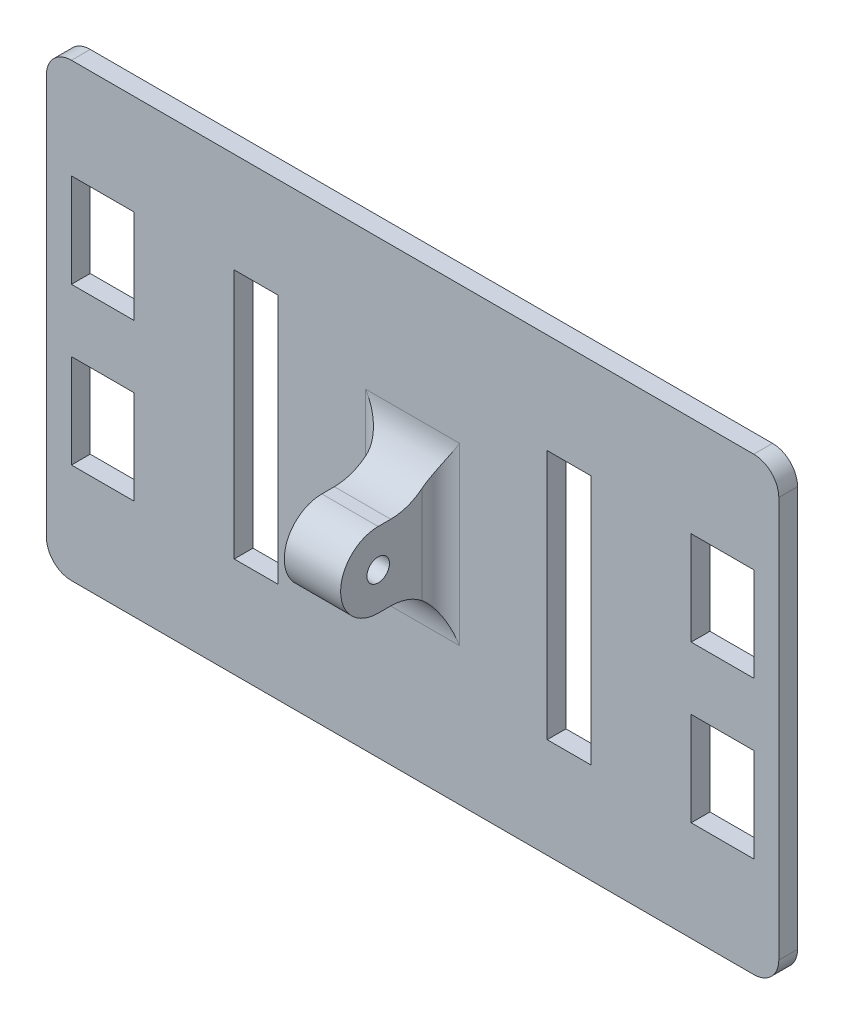
from build123d import *

# Parameters (mm, degrees)
SKETCH1_W           = 117
SKETCH1_H           = 72
BOSS_EXTRUDE1_DEPTH = 3
FILLET1_R           = 4
SKETCH2_R           = 1.8
BOSS_EXTRUDE2_DEPTH = 4.5
FILLET2_R           = 8
FILLET3_R           = 3
CUT_EXTRUDE3_REACH  = 140.687
SKETCH4_W           = 10
SKETCH4_H           = 15
SKETCH4_W_2         = 7
SKETCH4_H_2         = 40


with BuildPart() as part:
    # Sketch1 → Boss-Extrude1 (new body)
    with BuildSketch(Plane.XY):
        with Locations((58.5, 36)):
            Rectangle(SKETCH1_W, SKETCH1_H)
    extrude(amount=BOSS_EXTRUDE1_DEPTH)

    # Fillet1
    fillet1_edges = [part.edges().sort_by_distance(p)[0] for p in [
        (117, 72, 1.5),
        (0, 72, 1.5),
        (0, 0, 1.5),
        (117, 0, 1.5),
    ]]
    fillet(fillet1_edges, radius=FILLET1_R)

    # Sketch2 → Boss-Extrude2 (add, symmetric)
    with BuildSketch(Plane.ZY.offset(-58.5)):
        with BuildLine():
            Line((13, 30), (3, 30))
            Line((3, 30), (3, 42))
            Line((3, 42), (13, 42))
            ThreePointArc((13, 42), (19, 36), (13, 30))
        make_face()
        with Locations((13, 36)):
            Circle(SKETCH2_R, mode=Mode.SUBTRACT)
    extrude(amount=BOSS_EXTRUDE2_DEPTH, both=True)

    # Fillet2
    fillet2_edges = [part.edges().sort_by_distance(p)[0] for p in [
        (58.5, 42, 3),
        (58.5, 30, 3),
    ]]
    fillet(fillet2_edges, radius=FILLET2_R)

    # Fillet3
    fillet3_edges = [part.edges().sort_by_distance(p)[0] for p in [
        (54, 36, 3),
        (63, 36, 3),
    ]]
    fillet(fillet3_edges, radius=FILLET3_R)

    # Sketch4 → Cut-Extrude3 (cut, up to next)
    with BuildSketch(Plane(origin=(0, 0, 0), x_dir=(-1, 0, 0), z_dir=(0, 0, -1)), mode=Mode.PRIVATE) as cut_extrude3_sk1:
        with Locations((-108, 48.5)):
            Rectangle(SKETCH4_W, SKETCH4_H)
    cut_extrude3_tool1 = extrude(cut_extrude3_sk1.sketch, amount=-CUT_EXTRUDE3_REACH, mode=Mode.PRIVATE) & part.part
    # Sketch4 → Cut-Extrude3 (cut, up to next)
    with BuildSketch(Plane(origin=(0, 0, 0), x_dir=(-1, 0, 0), z_dir=(0, 0, -1)), mode=Mode.PRIVATE) as cut_extrude3_sk2:
        with Locations((-108, 23.5)):
            Rectangle(SKETCH4_W, SKETCH4_H)
    cut_extrude3_tool2 = extrude(cut_extrude3_sk2.sketch, amount=-CUT_EXTRUDE3_REACH, mode=Mode.PRIVATE) & part.part
    # Sketch4 → Cut-Extrude3 (cut, up to next)
    with BuildSketch(Plane(origin=(0, 0, 0), x_dir=(-1, 0, 0), z_dir=(0, 0, -1)), mode=Mode.PRIVATE) as cut_extrude3_sk3:
        with Locations((-83.5, 36)):
            Rectangle(SKETCH4_W_2, SKETCH4_H_2)
    cut_extrude3_tool3 = extrude(cut_extrude3_sk3.sketch, amount=-CUT_EXTRUDE3_REACH, mode=Mode.PRIVATE) & part.part
    # Sketch4 → Cut-Extrude3 (cut, up to next)
    with BuildSketch(Plane(origin=(0, 0, 0), x_dir=(-1, 0, 0), z_dir=(0, 0, -1)), mode=Mode.PRIVATE) as cut_extrude3_sk4:
        with Locations((-33.5, 36)):
            Rectangle(SKETCH4_W_2, SKETCH4_H_2)
    cut_extrude3_tool4 = extrude(cut_extrude3_sk4.sketch, amount=-CUT_EXTRUDE3_REACH, mode=Mode.PRIVATE) & part.part
    # Sketch4 → Cut-Extrude3 (cut, up to next)
    with BuildSketch(Plane(origin=(0, 0, 0), x_dir=(-1, 0, 0), z_dir=(0, 0, -1)), mode=Mode.PRIVATE) as cut_extrude3_sk5:
        with Locations((-9, 23.5)):
            Rectangle(SKETCH4_W, SKETCH4_H)
    cut_extrude3_tool5 = extrude(cut_extrude3_sk5.sketch, amount=-CUT_EXTRUDE3_REACH, mode=Mode.PRIVATE) & part.part
    # Sketch4 → Cut-Extrude3 (cut, up to next)
    with BuildSketch(Plane(origin=(0, 0, 0), x_dir=(-1, 0, 0), z_dir=(0, 0, -1)), mode=Mode.PRIVATE) as cut_extrude3_sk6:
        with Locations((-9, 48.5)):
            Rectangle(SKETCH4_W, SKETCH4_H)
    cut_extrude3_tool6 = extrude(cut_extrude3_sk6.sketch, amount=-CUT_EXTRUDE3_REACH, mode=Mode.PRIVATE) & part.part
    add(cut_extrude3_tool1.solids().sort_by_distance((108, 48.5, 0))[0], mode=Mode.SUBTRACT)
    add(cut_extrude3_tool2.solids().sort_by_distance((108, 23.5, 0))[0], mode=Mode.SUBTRACT)
    add(cut_extrude3_tool3.solids().sort_by_distance((83.5, 36, 0))[0], mode=Mode.SUBTRACT)
    add(cut_extrude3_tool4.solids().sort_by_distance((33.5, 36, 0))[0], mode=Mode.SUBTRACT)
    add(cut_extrude3_tool5.solids().sort_by_distance((9, 23.5, 0))[0], mode=Mode.SUBTRACT)
    add(cut_extrude3_tool6.solids().sort_by_distance((9, 48.5, 0))[0], mode=Mode.SUBTRACT)


solid = part.part
